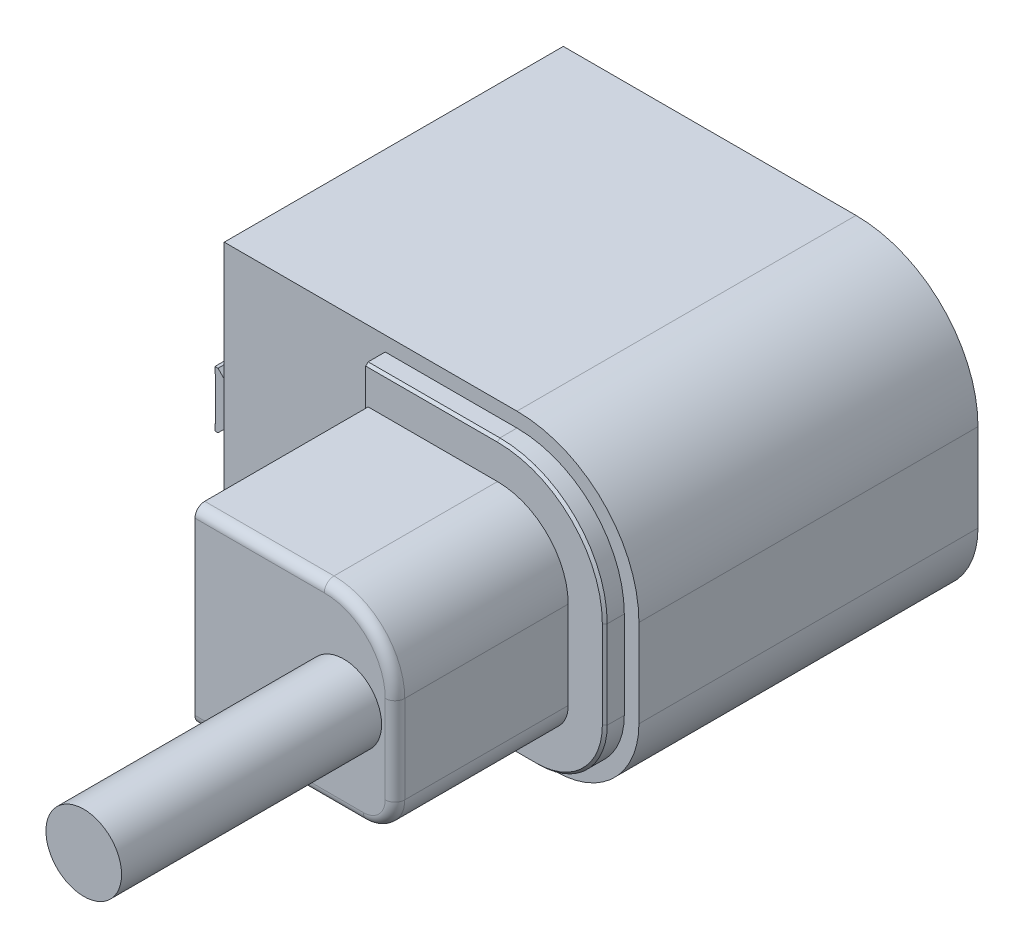
from build123d import *

# Parameters (mm, degrees)
SKETCH1_W           = 85
SKETCH1_H           = 60
BOSS_EXTRUDE1_DEPTH = 69.5
BOSS_EXTRUDE2_DEPTH = 66.05
SKETCH3_W           = 3.16
SKETCH3_H           = 1.25
CUT_EXTRUDE1_DEPTH  = 103.54309143
CUT_EXTRUDE2_DEPTH  = 114.821131606
CUT_EXTRUDE3_DEPTH  = 89.402972801
BOSS_EXTRUDE3_DEPTH = 4
CHAMFER1_SIZE       = 0.5
BOSS_EXTRUDE4_DEPTH = 35.5
SKETCH8_R           = 7.75
BOSS_EXTRUDE5_DEPTH = 53.3
FILLET1_R           = 2
SKETCH9_R           = 2
CUT_EXTRUDE4_DEPTH  = 10


with BuildPart() as part:
    # Sketch1 → Boss-Extrude1 (new body)
    with BuildSketch(Plane.XY):
        Rectangle(SKETCH1_W, SKETCH1_H)
    extrude(amount=BOSS_EXTRUDE1_DEPTH)

    # Sketch2 → Boss-Extrude2 (add)
    with BuildSketch(Plane.XY.offset(69.5)):
        Polygon((-42.5, 3.495), (-42.79, 3.495), (-45.03, 5.73), (-45.66, 5.73), (-45.66, 4.45), (-45.533118158, 4.45), (-45.533118158, -4.45), (-45.66, -4.45), (-45.66, -5.73), (-45.03, -5.73), (-42.79, -3.495), (-42.5, -3.495), align=None)
    extrude(amount=-BOSS_EXTRUDE2_DEPTH)

    # Sketch3 → Cut-Extrude1 (cut, through all)
    with BuildSketch(Plane.XZ.offset(30)):
        with Locations((-44.08, 68.875)):
            Rectangle(SKETCH3_W, SKETCH3_H)
    extrude(amount=-CUT_EXTRUDE1_DEPTH, mode=Mode.SUBTRACT)

    # Sketch4 → Cut-Extrude2 (cut, through all)
    with BuildSketch(Plane.ZY.offset(42.5)):
        Polygon((3.45, 2.7), (14.31, 5.73), (3.45, 5.73), align=None)
        Polygon((3.45, -5.73), (3.45, -2.7), (14.31, -5.73), align=None)
    extrude(amount=CUT_EXTRUDE2_DEPTH, mode=Mode.SUBTRACT)

    # Sketch5 → Cut-Extrude3 (cut, through all)
    with BuildSketch(Plane.XY.offset(69.5)):
        with BuildLine():
            Line((42.5, -30), (42.5, -13))
            ThreePointArc((42.5, -13), (37.52081528, -25.02081528), (25.5, -30))
            Line((25.5, -30), (42.5, -30))
        make_face()
        with BuildLine():
            ThreePointArc((17.5, 30), (35.17766953, 22.67766953), (42.5, 5))
            Line((42.5, 5), (42.5, 30))
            Line((42.5, 30), (17.5, 30))
        make_face()
    extrude(amount=-CUT_EXTRUDE3_DEPTH, mode=Mode.SUBTRACT)

    # Sketch6 → Boss-Extrude3 (add)
    with BuildSketch(Plane.XY.offset(69.5)):
        with BuildLine():
            Line((17.5, 27), (-9.5, 27))
            Line((-9.5, 27), (-9.5, -27))
            Line((-9.5, -27), (17.308513795, -27))
            Line((17.308513795, -27), (25.5, -27))
            ThreePointArc((25.5, -27), (35.399494937, -22.899494937), (39.5, -13))
            Line((39.5, -13), (39.5, 5))
            ThreePointArc((39.5, 5), (33.056349186, 20.556349186), (17.5, 27))
        make_face()
    extrude(amount=BOSS_EXTRUDE3_DEPTH)

    # Chamfer1
    chamfer1_edges = [part.edges().sort_by_distance(p)[0] for p in [
        (8, -27, 73.5),
        (35.399494937, -22.899494937, 73.5),
        (39.5, -4, 73.5),
        (33.056349186, 20.556349186, 73.5),
        (4, 27, 73.5),
    ]]
    chamfer(chamfer1_edges, length=CHAMFER1_SIZE)

    # Sketch7 → Boss-Extrude4 (add)
    with BuildSketch(Plane.XY.offset(73.5)):
        with BuildLine():
            Line((-9, 19.5), (-9, -19.5))
            Line((-9, -19.5), (25.5, -19.5))
            ThreePointArc((25.5, -19.5), (30.096194078, -17.596194078), (32, -13))
            Line((32, -13), (32, 5))
            ThreePointArc((32, 5), (27.753048327, 15.253048327), (17.5, 19.5))
            Line((17.5, 19.5), (-9, 19.5))
        make_face()
    extrude(amount=BOSS_EXTRUDE4_DEPTH)

    # Sketch8 → Boss-Extrude5 (add)
    with BuildSketch(Plane.XY.offset(109)):
        with Locations((21.5, 0)):
            Circle(SKETCH8_R)
    extrude(amount=BOSS_EXTRUDE5_DEPTH)

    # Fillet1
    fillet1_edges = [part.edges().sort_by_distance(p)[0] for p in [
        (4.25, 19.5, 109),
        (27.753048327, 15.253048327, 109),
        (32, -4, 109),
        (30.096194078, -17.596194078, 109),
        (8.25, -19.5, 109),
    ]]
    fillet(fillet1_edges, radius=FILLET1_R)

    # Sketch9 → Cut-Extrude4 (cut)
    with BuildSketch(Plane.ZY.offset(45.533118158)):
        with Locations((55, 0)):
            Circle(SKETCH9_R)
        with Locations((35, 0)):
            Circle(SKETCH9_R)
    extrude(amount=-CUT_EXTRUDE4_DEPTH, mode=Mode.SUBTRACT)


solid = part.part
